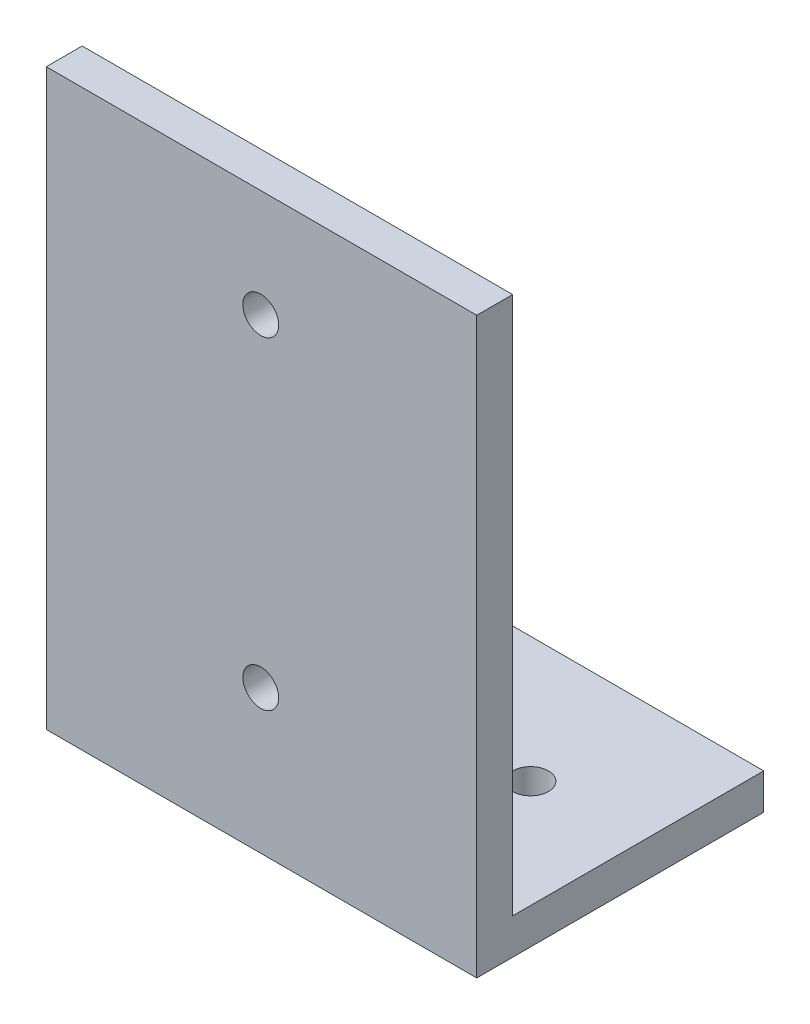
from build123d import *

# Parameters (mm, degrees)
BOSS_EXTRUDE1_DEPTH = 38.1
CUT_EXTRUDE1_REACH  = 68.067
SKETCH2_R           = 1.5875
CUT_EXTRUDE2_REACH  = 69.277
SKETCH3_R           = 1.5875


with BuildPart() as part:
    # Sketch1 → Boss-Extrude1 (new body)
    with BuildSketch(Plane(origin=(0, 0, 0), x_dir=(0, 0, -1), z_dir=(1, 0, 0))):
        Polygon((0, 0), (0, 50.8), (3.175, 50.8), (3.175, 3.175), (25.4, 3.175), (25.4, 0), align=None)
    extrude(amount=BOSS_EXTRUDE1_DEPTH)

    # Sketch2 → Cut-Extrude1 (cut, up to next)
    with BuildSketch(Plane(origin=(0, 3.175, 0), x_dir=(1, 0, 0), z_dir=(0, 1, 0)), mode=Mode.PRIVATE) as cut_extrude1_sk1:
        with Locations((28.575, 14.2875)):
            Circle(SKETCH2_R)
    cut_extrude1_tool1 = extrude(cut_extrude1_sk1.sketch, amount=-CUT_EXTRUDE1_REACH, mode=Mode.PRIVATE) & part.part
    # Sketch2 → Cut-Extrude1 (cut, up to next)
    with BuildSketch(Plane(origin=(0, 3.175, 0), x_dir=(1, 0, 0), z_dir=(0, 1, 0)), mode=Mode.PRIVATE) as cut_extrude1_sk2:
        with Locations((9.525, 14.2875)):
            Circle(SKETCH2_R)
    cut_extrude1_tool2 = extrude(cut_extrude1_sk2.sketch, amount=-CUT_EXTRUDE1_REACH, mode=Mode.PRIVATE) & part.part
    add(cut_extrude1_tool1.solids().sort_by_distance((28.575, 3.175, -14.2875))[0], mode=Mode.SUBTRACT)
    add(cut_extrude1_tool2.solids().sort_by_distance((9.525, 3.175, -14.2875))[0], mode=Mode.SUBTRACT)

    # Sketch3 → Cut-Extrude2 (cut, up to next)
    with BuildSketch(Plane(origin=(0, 0, -3.175), x_dir=(-1, 0, 0), z_dir=(0, 0, -1)), mode=Mode.PRIVATE) as cut_extrude2_sk1:
        with Locations((-18.983298196, 12.7)):
            Circle(SKETCH3_R)
    cut_extrude2_tool1 = extrude(cut_extrude2_sk1.sketch, amount=-CUT_EXTRUDE2_REACH, mode=Mode.PRIVATE) & part.part
    # Sketch3 → Cut-Extrude2 (cut, up to next)
    with BuildSketch(Plane(origin=(0, 0, -3.175), x_dir=(-1, 0, 0), z_dir=(0, 0, -1)), mode=Mode.PRIVATE) as cut_extrude2_sk2:
        with Locations((-18.983298196, 41.275)):
            Circle(SKETCH3_R)
    cut_extrude2_tool2 = extrude(cut_extrude2_sk2.sketch, amount=-CUT_EXTRUDE2_REACH, mode=Mode.PRIVATE) & part.part
    add(cut_extrude2_tool1.solids().sort_by_distance((18.983298, 12.7, -3.175))[0], mode=Mode.SUBTRACT)
    add(cut_extrude2_tool2.solids().sort_by_distance((18.983298, 41.275, -3.175))[0], mode=Mode.SUBTRACT)


solid = part.part
